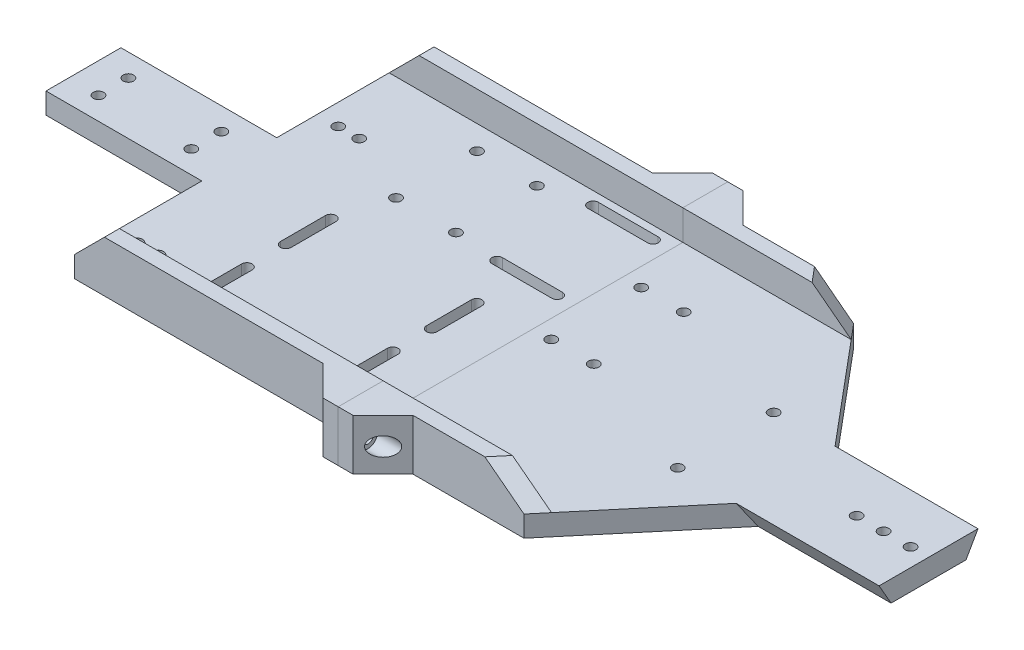
from build123d import *

# Parameters (mm, degrees)
SALIENTE_EXTRUIR1_DEPTH   = 3.5
SALIENTE_EXTRUIR2_DEPTH   = 10
SALIENTE_EXTRUIR3_DEPTH   = 17
SALIENTE_EXTRUIR4_REACH   = 294.767
CROQUIS7_R                = 1.75
CORTAR_EXTRUIR5_DEPTH     = 293.626468386
CHAFL_N1_SIZE             = 10
CROQUIS12_R               = 1.75
CORTAR_EXTRUIR8_DEPTH     = 170.376798883
CROQUIS14_R               = 3.1
CORTAR_EXTRUIR9_DEPTH     = 174.820309515
SIMETR_A3_COPY_1_SKETCH_R = 3.1
SIMETR_A3_COPY_1_DEPTH    = 174.820309515
CORTAR_EXTRUIR10_DEPTH    = 293.626468386
CORTAR_EXTRUIR11_DEPTH    = 293.626468386
CROQUIS18_R               = 1.75
CORTAR_EXTRUIR12_DEPTH    = 293.626468386


with BuildPart() as part:
    # Croquis1 → Saliente-Extruir1 (new, symmetric)
    with BuildSketch(Plane(origin=(0, 0, 0), x_dir=(1, 0, 0), z_dir=(0, 1, 0))):
        Polygon((282, 25), (282, 0), (237.661734325, 0), (202, -42.5), (52, -42.5), (52, 0), (0, 0), (0, 25), (52, 25), (52, 67.5), (202, 67.5), (237.661734325, 25), align=None)
    extrude(amount=SALIENTE_EXTRUIR1_DEPTH, both=True)

    # Croquis6 → Saliente-Extruir2 (add)
    with BuildSketch(Plane(origin=(0, 3.5, 0), x_dir=(1, 0, 0), z_dir=(0, 1, 0))):
        Polygon((52, 67.5), (202, 67.5), (206.195498156, 62.5), (52, 62.5), align=None)
        Polygon((52, -37.5), (52, -42.5), (202, -42.5), (206.195498156, -37.5), align=None)
    extrude(amount=SALIENTE_EXTRUIR2_DEPTH)

    # Croquis9 → Saliente-Extruir3 (add)
    with BuildSketch(Plane(origin=(0, -3.5, 0), x_dir=(1, 0, 0), z_dir=(0, 1, 0))):
        Polygon((145, -52.5), (135, -42.5), (165, -42.5), (155, -52.5), align=None)
        Polygon((135, 67.5), (165, 67.5), (155, 77.5), (145, 77.5), align=None)
    extrude(amount=SALIENTE_EXTRUIR3_DEPTH)

    # Croquis15 → Saliente-Extruir4 (add, up to next)
    with BuildSketch(Plane(origin=(282, 0, 0), x_dir=(0, 0, -1), z_dir=(1, 0, 0)), mode=Mode.PRIVATE) as saliente_extruir4_sk1:
        Polygon((0, -3.5), (0, 3.5), (-4, 3.5), align=None)
    saliente_extruir4_tool1 = extrude(saliente_extruir4_sk1.sketch, amount=-SALIENTE_EXTRUIR4_REACH, mode=Mode.PRIVATE) - part.part
    # Croquis15 → Saliente-Extruir4 (add, up to next)
    with BuildSketch(Plane(origin=(282, 0, 0), x_dir=(0, 0, -1), z_dir=(1, 0, 0)), mode=Mode.PRIVATE) as saliente_extruir4_sk2:
        Polygon((25, -3.5), (25, 3.5), (29, 3.5), align=None)
    saliente_extruir4_tool2 = extrude(saliente_extruir4_sk2.sketch, amount=-SALIENTE_EXTRUIR4_REACH, mode=Mode.PRIVATE) - part.part
    add(saliente_extruir4_tool1.solids().sort_by_distance((282, 1.166667, 1.333333))[0])
    add(saliente_extruir4_tool2.solids().sort_by_distance((282, 1.166667, -26.333333))[0])

    # Croquis7 → Cortar-Extruir5 (cut, through all)
    with BuildSketch(Plane(origin=(0, 3.5, 0), x_dir=(1, 0, 0), z_dir=(0, 1, 0))):
        with Locations(Location((214.3053358, 28.5, 0), (0, 0, 270))):
            Circle(CROQUIS7_R)
        with Locations(Location((214.3053358, -3.5, 0), (0, 0, 270))):
            Circle(CROQUIS7_R)
    extrude(amount=-CORTAR_EXTRUIR5_DEPTH, mode=Mode.SUBTRACT)

    # Chaflán1
    # the kernel refuses this chamfer: 10 mm, written as the material it takes off along each edge
    with BuildSketch(Plane(origin=(52, 13.5, 11.78317012), x_dir=(-0.027495876610586317, -0.9996219169112968, 0), z_dir=(0, 0, 1))) as chafl_n1_piece_1:
        Polygon((CHAFL_N1_SIZE * 0.999621916911, CHAFL_N1_SIZE * 0.0274958766106), (-CHAFL_N1_SIZE * 0.0274958766106, CHAFL_N1_SIZE * 0.999621916911), (0, 0), align=None)
    extrude(amount=56.433659759, mode=Mode.SUBTRACT)
    with BuildSketch(Plane(origin=(52, 13.5, -36.78317012), x_dir=(-0.027495876610586317, -0.9996219169112968, 0), z_dir=(0, 0, -1))) as chafl_n1_piece_2:
        Polygon((CHAFL_N1_SIZE * 0.999621916911, -CHAFL_N1_SIZE * 0.0274958766106), (-CHAFL_N1_SIZE * 0.0274958766106, -CHAFL_N1_SIZE * 0.999621916911), (0, 0), align=None)
    extrude(amount=56.433659759, mode=Mode.SUBTRACT)
    with BuildSketch(Plane(origin=(185.469540393, 13.5, -87.200234624), x_dir=(0.021063063486225234, -0.9996219169112968, -0.017674008802755378), z_dir=(0.6427876096865426, 0, 0.7660444431189753))) as chafl_n1_piece_3:
        Polygon((CHAFL_N1_SIZE * 0.999621916911, -CHAFL_N1_SIZE * 0.0274958766106), (-CHAFL_N1_SIZE * 0.0274958766106, -CHAFL_N1_SIZE * 0.999621916911), (0, 0), align=None)
    extrude(amount=57.960696206, mode=Mode.SUBTRACT)
    with BuildSketch(Plane(origin=(185.469540393, 13.5, 62.200234624), x_dir=(0.021063063486226254, -0.9996219169112968, 0.017674008802756234), z_dir=(0.6427876096865426, 0, -0.7660444431189753))) as chafl_n1_piece_4:
        Polygon((CHAFL_N1_SIZE * 0.999621916911, CHAFL_N1_SIZE * 0.0274958766106), (-CHAFL_N1_SIZE * 0.0274958766106, CHAFL_N1_SIZE * 0.999621916911), (0, 0), align=None)
    extrude(amount=57.960696206, mode=Mode.SUBTRACT)

    # Croquis12 → Cortar-Extruir8 (cut, symmetric)
    with BuildSketch(Plane(origin=(150, 0, 0), x_dir=(0, 0, -1), z_dir=(1, 0, 0))):
        with Locations((-47.5, 4.5)):
            Circle(CROQUIS12_R)
    cortar_extruir8 = extrude(amount=CORTAR_EXTRUIR8_DEPTH, both=True, mode=Mode.SUBTRACT)

    # Croquis14 → Cortar-Extruir9 (cut, through all)
    with BuildSketch(Plane(origin=(155, 0, 0), x_dir=(0, 0, -1), z_dir=(1, 0, 0))):
        with Locations(Location((-47.5, 4.5, 0), (0, 0, 180))):
            Circle(CROQUIS14_R)
    cortar_extruir9 = extrude(amount=CORTAR_EXTRUIR9_DEPTH, mode=Mode.SUBTRACT)

    # Simetría2: Cortar-Extruir9 across plane
    add(cortar_extruir9.mirror(Plane(origin=(150, 0, 0), x_dir=(0, 0, 1), z_dir=(1, 0, 0))), mode=Mode.SUBTRACT)

    # Simetría3: Cortar-Extruir8, Cortar-Extruir9 across plane
    add(cortar_extruir8.mirror(Plane.XY.offset(-12.5)), mode=Mode.SUBTRACT)
    add(cortar_extruir9.mirror(Plane.XY.offset(-12.5)), mode=Mode.SUBTRACT)

    # Simetría3 copy 1 sketch → Simetría3 copy 1 (cut, through all)
    with BuildSketch(Plane(origin=(145, 0, -25), x_dir=(0, 0, 1), z_dir=(-1, 0, 0))):
        with Locations(Location((-47.5, 4.5, 0), (0, 0, 180))):
            Circle(SIMETR_A3_COPY_1_SKETCH_R)
    extrude(amount=SIMETR_A3_COPY_1_DEPTH, mode=Mode.SUBTRACT)

    # Croquis16 → Cortar-Extruir10 (cut, through all)
    with BuildSketch(Plane(origin=(0, 3.5, 0), x_dir=(1, 0, 0), z_dir=(0, 1, 0))):
        with BuildLine():
            Line((82.61, -32.335873866), (82.61, -17.335873866))
            ThreePointArc((82.61, -17.335873866), (84.36, -15.585873866), (86.11, -17.335873866))
            Line((86.11, -17.335873866), (86.11, -32.335873866))
            ThreePointArc((86.11, -32.335873866), (84.36, -34.085873866), (82.61, -32.335873866))
        make_face()
        with BuildLine():
            Line((86.11, 10.664126134), (86.11, -4.335873866))
            ThreePointArc((86.11, -4.335873866), (84.36, -6.085873866), (82.61, -4.335873866))
            Line((82.61, -4.335873866), (82.61, 10.664126134))
            ThreePointArc((82.61, 10.664126134), (84.36, 12.414126134), (86.11, 10.664126134))
        make_face()
        with BuildLine():
            Line((134.81, 10.664126134), (134.81, -4.335873866))
            ThreePointArc((134.81, -4.335873866), (133.06, -6.085873866), (131.31, -4.335873866))
            Line((131.31, -4.335873866), (131.31, 10.664126134))
            ThreePointArc((131.31, 10.664126134), (133.06, 12.414126134), (134.81, 10.664126134))
        make_face()
        with BuildLine():
            Line((134.81, -17.335873866), (134.81, -32.335873866))
            ThreePointArc((134.81, -32.335873866), (133.06, -34.085873866), (131.31, -32.335873866))
            Line((131.31, -32.335873866), (131.31, -17.335873866))
            ThreePointArc((131.31, -17.335873866), (133.06, -15.585873866), (134.81, -17.335873866))
        make_face()
    extrude(amount=-CORTAR_EXTRUIR10_DEPTH, mode=Mode.SUBTRACT)

    # Croquis17 → Cortar-Extruir11 (cut, through all)
    with BuildSketch(Plane(origin=(0, 3.5, 0), x_dir=(1, 0, 0), z_dir=(0, 1, 0))):
        with BuildLine():
            Line((124.3, 60), (144.3, 60))
            ThreePointArc((144.3, 60), (146.05, 58.25), (144.3, 56.5))
            Line((144.3, 56.5), (124.3, 56.5))
            ThreePointArc((124.3, 56.5), (122.55, 58.25), (124.3, 60))
        make_face()
        with BuildLine():
            Line((124.3, 28), (144.3, 28))
            ThreePointArc((144.3, 28), (146.05, 26.25), (144.3, 24.5))
            Line((144.3, 24.5), (124.3, 24.5))
            ThreePointArc((124.3, 24.5), (122.55, 26.25), (124.3, 28))
        make_face()
    extrude(amount=-CORTAR_EXTRUIR11_DEPTH, mode=Mode.SUBTRACT)

    # Croquis18 → Cortar-Extruir12 (cut, through all)
    with BuildSketch(Plane(origin=(0, 3.5, 0), x_dir=(1, 0, 0), z_dir=(0, 1, 0))):
        with Locations(Location((10, 17.5, 0), (0, 0, 270))):
            Circle(CROQUIS18_R)
        with Locations(Location((10, 7.5, 0), (0, 0, 270))):
            Circle(CROQUIS18_R)
        with Locations(Location((41, 17.5, 0), (0, 0, 270))):
            Circle(CROQUIS18_R)
        with Locations(Location((41, 7.5, 0), (0, 0, 270))):
            Circle(CROQUIS18_R)
        with Locations(Location((59, 38.5, 0), (0, 0, 270))):
            Circle(CROQUIS18_R)
        with Locations(Location((66, 38.5, 0), (0, 0, 270))):
            Circle(CROQUIS18_R)
        with Locations(Location((66, -28.5, 0), (0, 0, 270))):
            Circle(CROQUIS18_R)
        with Locations(Location((59, -28.5, 0), (0, 0, 270))):
            Circle(CROQUIS18_R)
        with Locations(Location((89.3, 27.5, 0), (0, 0, 270))):
            Circle(CROQUIS18_R)
        with Locations(Location((109.3, 27.5, 0), (0, 0, 270))):
            Circle(CROQUIS18_R)
        with Locations(Location((109.3, 54.5, 0), (0, 0, 270))):
            Circle(CROQUIS18_R)
        with Locations(Location((89.3, 54.5, 0), (0, 0, 270))):
            Circle(CROQUIS18_R)
        with Locations(Location((156.1, 42.5, 0), (0, 0, 270))):
            Circle(CROQUIS18_R)
        with Locations(Location((170.3, 42.5, 0), (0, 0, 270))):
            Circle(CROQUIS18_R)
        with Locations(Location((156.1, 12.5, 0), (0, 0, 270))):
            Circle(CROQUIS18_R)
        with Locations(Location((170.3, 12.5, 0), (0, 0, 270))):
            Circle(CROQUIS18_R)
        with Locations(Location((214.3053358, 28.5, 0), (0, 0, 270))):
            Circle(CROQUIS18_R)
        with Locations(Location((214.3053358, -3.5, 0), (0, 0, 270))):
            Circle(CROQUIS18_R)
        with Locations(Location((258, 12.5, 0), (0, 0, 270))):
            Circle(CROQUIS18_R)
        with Locations(Location((267, 12.5, 0), (0, 0, 270))):
            Circle(CROQUIS18_R)
        with Locations(Location((276, 12.5, 0), (0, 0, 270))):
            Circle(CROQUIS18_R)
    extrude(amount=-CORTAR_EXTRUIR12_DEPTH, mode=Mode.SUBTRACT)


with BuildPart() as body_2:
    # Partir1: the piece on the far side of the plane
    add(part.part)
    split(bisect_by=Plane(origin=(150, 0, 0), x_dir=(0, 0, 1), z_dir=(1, 0, 0)), keep=Keep.BOTTOM)


with BuildPart() as part_1:
    add(part.part)

    # Partir1
    split(bisect_by=Plane(origin=(150, 0, 0), x_dir=(0, 0, 1), z_dir=(1, 0, 0)), keep=Keep.TOP)


solid = Compound([body_2.part, part_1.part])
